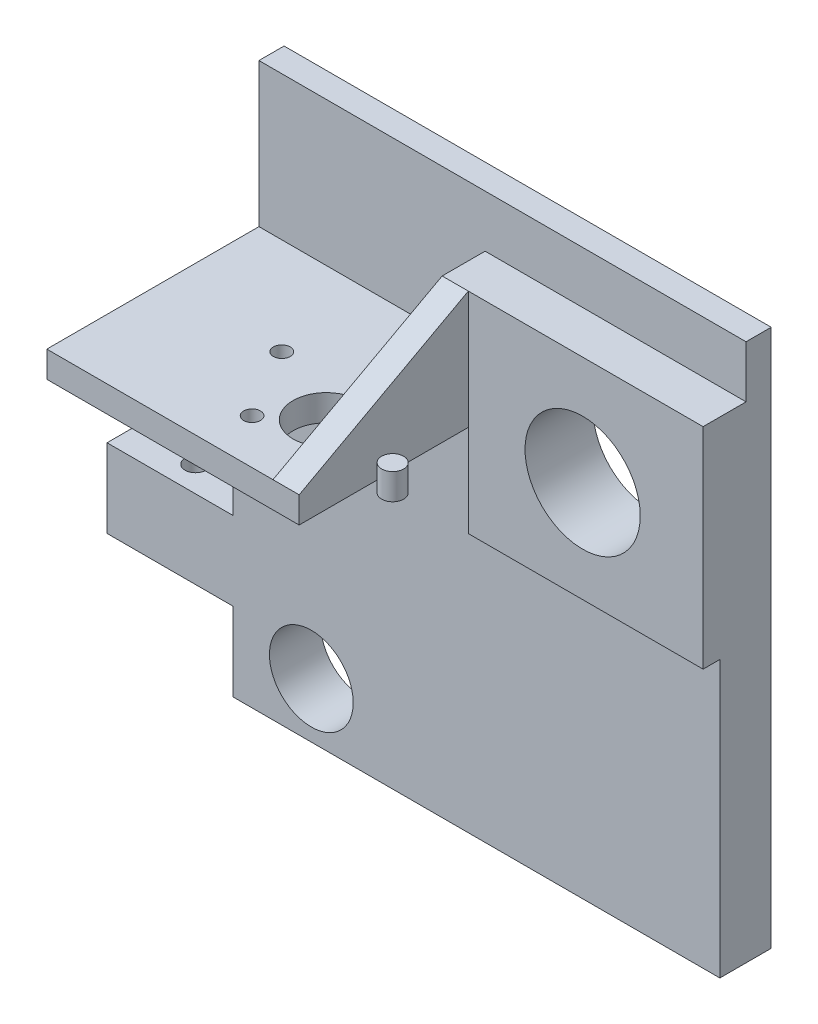
from build123d import *

# Parameters (mm, degrees)
SKETCH1_R                 = 11
SKETCH1_R_2               = 8
BOSS_EXTRUDE1_DEPTH       = 4.8
SKETCH2_W                 = 44.821432693
SKETCH2_H                 = 40.097165435
SKETCH2_R                 = 11
BOSS_EXTRUDE2_DEPTH       = 8.2
SKETCH3_W                 = 24
SKETCH3_H                 = 15
SKETCH3_R                 = 8
BOSS_EXTRUDE3_DEPTH       = 5
BOSS_EXTRUDE4_OUTLINE_R   = 2.1
BOSS_EXTRUDE4_OUTLINE_W   = 48.178567307
BOSS_EXTRUDE4_OUTLINE_H   = 40.5
BOSS_EXTRUDE4_OUTLINE_R_2 = 1.6
BOSS_EXTRUDE4_OUTLINE_R_3 = 6.35
BOSS_EXTRUDE4_DEPTH       = 5
BOSS_EXTRUDE5_DEPTH       = 5
SKETCH6_W                 = 48.178567307
SKETCH6_H                 = 17.568704936
BOSS_EXTRUDE6_DEPTH       = 5
SKETCH8_R                 = 2
CUT_EXTRUDE1_DEPTH        = 127.437257167


# Read off the part's stored shape, not the designer's step: Boss-Extrude4
with BuildPart() as part:
    # Sketch1 → Boss-Extrude1 (new body)
    # profile 1 of 2: a face of its own
    with BuildSketch(Plane.XY):
        Polygon((0, 0), (93, 0), (93, 102.7), (0, 102.7), (0, 30), (-24, 30), (-24, 15), (0, 15), align=None)
        with Locations((15, 10.5)):
            Circle(SKETCH1_R, mode=Mode.SUBTRACT)
        with Locations((70, 72)):
            Circle(SKETCH1_R, mode=Mode.SUBTRACT)
    # profile 2 of 2: a face of its own
    with BuildSketch(Plane.XY):
        with BuildLine():
            ThreePointArc((26, 10.5), (8.48332569, 19.36188219), (11.721280738, 0))
            Line((11.721280738, 0), (18.278719262, 0))
            ThreePointArc((18.278719262, 0), (23.86188219, 3.98332569), (26, 10.5))
        make_face()
        with Locations((15, 10.5)):
            Circle(SKETCH1_R_2, mode=Mode.SUBTRACT)
    extrude(amount=BOSS_EXTRUDE1_DEPTH)

    # Sketch2 → Boss-Extrude2 (add)
    with BuildSketch(Plane.XY.offset(4.8)):
        with Locations((70.589283654, 72.714594712)):
            Rectangle(SKETCH2_W, SKETCH2_H)
        with Locations((70, 72)):
            Circle(SKETCH2_R, mode=Mode.SUBTRACT)
    extrude(amount=BOSS_EXTRUDE2_DEPTH)

    # Sketch3 → Boss-Extrude3 (add)
    # profile 1 of 2: a face of its own
    with BuildSketch(Plane.XY.offset(4.8)):
        with Locations((-12, 22.5)):
            Rectangle(SKETCH3_W, SKETCH3_H)
    # profile 2 of 2: a face of its own
    with BuildSketch(Plane.XY.offset(4.8)):
        Polygon((0, 30), (0, 15), (0, 0), (93, 0), (93, 52.666011994), (48.178567307, 52.666011994), (0, 52.666011994), align=None)
        with Locations((15, 10.5)):
            Circle(SKETCH3_R, mode=Mode.SUBTRACT)
    extrude(amount=BOSS_EXTRUDE3_DEPTH)

    # Boss-Extrude4 outline → Boss-Extrude4 (add)
    # profile 1 of 2: a face of its own
    with BuildSketch(Plane.XZ.offset(-75.23471693)):
        with Locations((51.783815806, 31.05)):
            Circle(BOSS_EXTRUDE4_OUTLINE_R)
    # profile 2 of 2: a face of its own
    with BuildSketch(Plane.XZ.offset(-75.23471693)):
        with Locations((24.089283654, 25.05)):
            Rectangle(BOSS_EXTRUDE4_OUTLINE_W, BOSS_EXTRUDE4_OUTLINE_H)
        with Locations((22.860422048, 23.3)):
            Circle(BOSS_EXTRUDE4_OUTLINE_R_2, mode=Mode.SUBTRACT)
        with Locations((38.360422048, 30.3)):
            Circle(BOSS_EXTRUDE4_OUTLINE_R_3, mode=Mode.SUBTRACT)
        with Locations((30.610422048, 36.723393759)):
            Circle(BOSS_EXTRUDE4_OUTLINE_R_2, mode=Mode.SUBTRACT)
        with Locations((46.110422048, 36.723393759)):
            Circle(BOSS_EXTRUDE4_OUTLINE_R_2, mode=Mode.SUBTRACT)
    extrude(amount=BOSS_EXTRUDE4_DEPTH)

    # Sketch5 → Boss-Extrude5 (add)
    with BuildSketch(Plane(origin=(48.178567307, 0, 0), x_dir=(0, 0, -1), z_dir=(1, 0, 0))):
        Polygon((-45.3, 75.23471693), (-13, 92.763177429), (-4.8, 92.763177429), (-4.8, 70.23471693), (-45.3, 70.23471693), align=None)
    extrude(amount=-BOSS_EXTRUDE5_DEPTH)

    # Sketch6 → Boss-Extrude6 (add)
    with BuildSketch(Plane.XY.offset(4.8)):
        with Locations((24.089283654, 61.450364462)):
            Rectangle(SKETCH6_W, SKETCH6_H)
    extrude(amount=BOSS_EXTRUDE6_DEPTH)

    # Sketch8 → Cut-Extrude1 (cut, through all)
    with BuildSketch(Plane(origin=(0, 30, 0), x_dir=(1, 0, 0), z_dir=(0, 1, 0))):
        with Locations(Location((-12, -4.9, 0), (0, 0, 180))):
            Circle(SKETCH8_R)
    extrude(amount=-CUT_EXTRUDE1_DEPTH, mode=Mode.SUBTRACT)


solid = part.part
